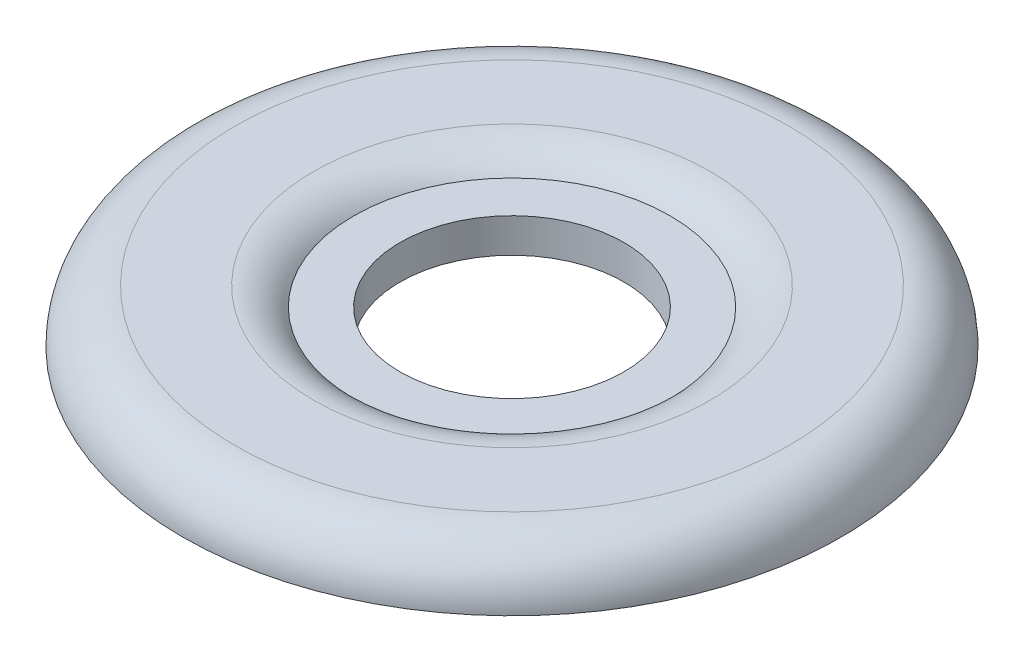
from build123d import *

# Parameters (mm, degrees)
FILLET1_R = 2


with BuildPart() as part:
    # Sketch1 → Revolve1 (revolve)
    with BuildSketch(Plane.XY, mode=Mode.PRIVATE) as revolve1_sk:
        Polygon((-12.5, 1), (-12.5, -1), (-11, -1), (-11, -0.3), (-7, -0.3), (-7, -1), (-4.25, -1), (-4.25, 0.3), (-6, 0.3), (-6, 1), align=None)
    revolve(revolve1_sk.sketch.rotate(Axis((0, 0.3, 0), (0, -1, 0)), 270), axis=Axis((0, 0.3, 0), (0, -1, 0)))

    # Fillet1
    # the kernel refuses this fillet: 2 mm, written as the material it adds along each edge
    with BuildSketch(Plane(origin=(0, -0.3, 0), x_dir=(0, 0, 1), z_dir=(1, 0, 0))) as fillet1_piece_1:
        with BuildLine():
            CenterArc((8.519868415, 2), FILLET1_R, 220.541601874, 49.458398126)
            Line((7, 0.7), (6.969602632, 0.674))
            ThreePointArc((6.969602632, 0.674), (6.96, 0.35), (6.96, 0))
            Line((6.96, 0), (7, -0.04))
            Line((7, -0.04), (8.519868415, -0.04))
            Line((8.519868415, -0.04), (8.519868415, 0))
        make_face()
    revolve(axis=Axis((0, -0.3, 0), (0, -1, 0)))
    with BuildSketch(Plane(origin=(0, -0.3, 0), x_dir=(0, 0, 1), z_dir=(1, 0, 0))) as fillet1_piece_2:
        with BuildLine():
            CenterArc((9.480131585, 2), FILLET1_R, 270, 49.458398126)
            Line((9.480131585, 0), (9.480131585, -0.04))
            Line((9.480131585, -0.04), (11, -0.04))
            Line((11, -0.04), (11.04, 0))
            ThreePointArc((11.04, 0), (11.04, 0.35), (11.030397368, 0.674))
            Line((11.030397368, 0.674), (11, 0.7))
        make_face()
    revolve(axis=Axis((0, -0.3, 0), (0, -1, 0)))
    # the kernel refuses this fillet: 2 mm, written as the material it takes off along each edge
    with BuildSketch(Plane(origin=(0, 1, 0), x_dir=(0, 0, 1), z_dir=(1, 0, 0))) as fillet1_2_piece_1:
        with BuildLine():
            CenterArc((12.5 - FILLET1_R, FILLET1_R), FILLET1_R, 270, 90)
            Line((12.5 - FILLET1_R, 0), (12.5 - FILLET1_R, -FILLET1_R * 0.02))
            Line((12.5 - FILLET1_R, -FILLET1_R * 0.02), (12.5 + FILLET1_R * 0.02, -FILLET1_R * 0.02))
            Line((12.5 + FILLET1_R * 0.02, -FILLET1_R * 0.02), (12.5 + FILLET1_R * 0.02, FILLET1_R))
            Line((12.5 + FILLET1_R * 0.02, FILLET1_R), (12.5, FILLET1_R))
        make_face()
    revolve(axis=Axis((0, 1, 0), (0, -1, 0)), mode=Mode.SUBTRACT)
    with BuildSketch(Plane(origin=(0, 1, 0), x_dir=(0, 0, 1), z_dir=(1, 0, 0))) as fillet1_2_piece_2:
        with BuildLine():
            CenterArc((7.519868415, 2), FILLET1_R, 220.541601874, 49.458398126)
            Line((6, 0.7), (5.969602632, 0.674))
            ThreePointArc((5.969602632, 0.674), (5.96, 0.35), (5.96, 0))
            Line((5.96, 0), (6, -0.04))
            Line((6, -0.04), (7.519868415, -0.04))
            Line((7.519868415, -0.04), (7.519868415, 0))
        make_face()
    revolve(axis=Axis((0, 1, 0), (0, -1, 0)), mode=Mode.SUBTRACT)


solid = part.part
